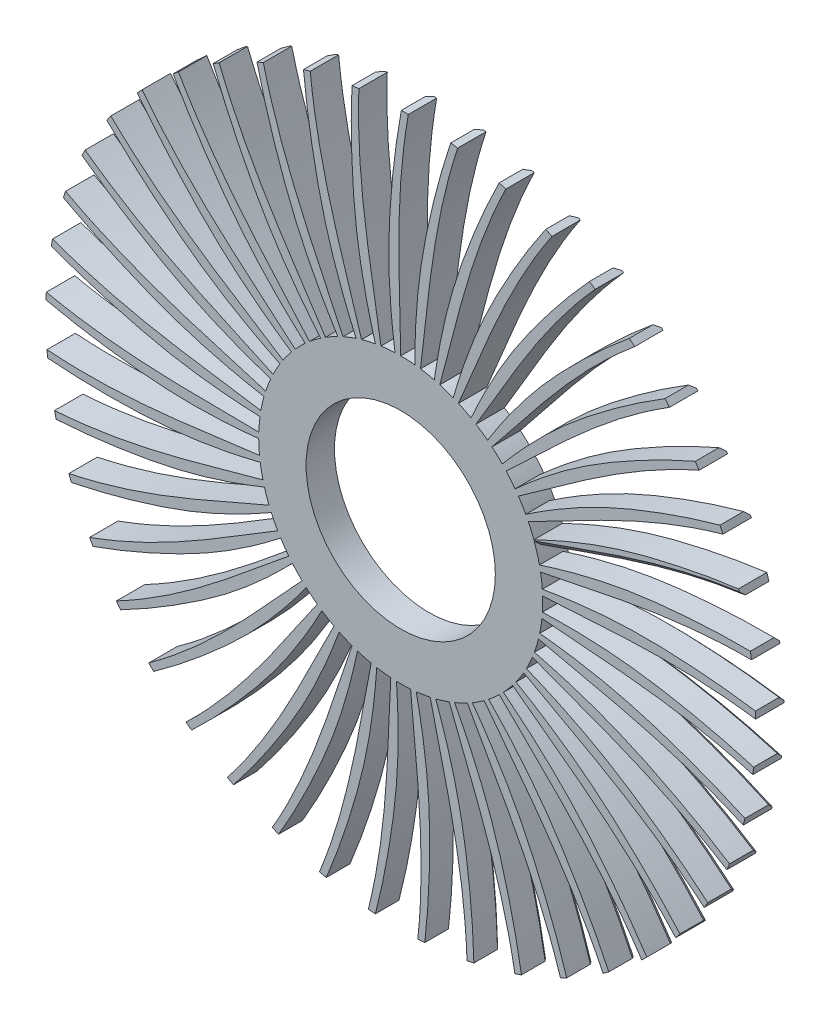
from build123d import *

# Parameters (mm, degrees)
BOSS_EXTRUDE1_DEPTH = 30
CHAMFER1_SIZE       = 5
SKETCH4_R           = 100
CUT_EXTRUDE4_DEPTH  = 30


with BuildPart() as part:
    # Sketch2 → Boss-Extrude1 (new body)
    with BuildSketch(Plane.XY):
        with BuildLine():
            ThreePointArc((-367.818143925, 73.039804216), (-368.519088855, 69.416720967), (-369.184346577, 65.786915438))
            add(Edge.make_bspline(
                [(-148.644827779, 20.117534009), (-208.67442649, 22.353179801), (-256.791443609, 31.100647398), (-328.615150785, 51.598785702), (-352.922592098, 59.639700165), (-369.184346577, 65.786915438)],
                knots=[0, 0, 0, 0, 0.599000586, 0.68864658, 0.896459938, 0.896459938, 0.896459938, 0.896459938], degree=3))
            ThreePointArc((-148.644827779, 20.117534009), (-149.462081869, 12.69196925), (-149.908624053, 5.234924505))
            add(Edge.make_bspline(
                [(-149.908624053, 5.234924505), (-225.73533437, 6.314146942), (-293.967928078, 3.961468461), (-374.403739079, 21.138594182)],
                knots=[0, 0, 0, 0, 0.908524, 0.908524, 0.908524, 0.908524], degree=3))
            ThreePointArc((-374.403739079, 21.138594182), (-374.59362673, 17.453217852), (-374.747238918, 13.76615136))
            add(Edge.make_bspline(
                [(-149.998046125, -0.765610073), (-209.754582665, -6.906226834), (-258.620740472, -4.940483472), (-332.598253739, 5.36224031), (-357.788215705, 9.941959162), (-374.747238918, 13.76615136)],
                knots=[0, 0, 0, 0, 0.599000586, 0.68864658, 0.896459938, 0.896459938, 0.896459938, 0.896459938], degree=3))
            ThreePointArc((-149.998046125, -0.765610073), (-149.77390788, -8.232649532), (-149.178284305, -15.67926949))
            add(Edge.make_bspline(
                [(-149.178284305, -15.67926949), (-224.417253024, -25.163588382), (-291.65838226, -36.989512411), (-373.701991329, -31.174054542)],
                knots=[0, 0, 0, 0, 0.908524, 0.908524, 0.908524, 0.908524], degree=3))
            ThreePointArc((-373.701991329, -31.174054542), (-373.377125755, -34.849992297), (-373.016102523, -38.522555195))
            add(Edge.make_bspline(
                [(-148.431723123, -21.633852425), (-206.752104481, -36.031211619), (-255.416278799, -40.88545345), (-330.107710009, -40.978674991), (-355.689898671, -39.949290768), (-373.016102523, -38.522555195)],
                knots=[0, 0, 0, 0, 0.599000586, 0.68864658, 0.896459938, 0.896459938, 0.896459938, 0.896459938], degree=3))
            ThreePointArc((-148.431723123, -21.633852425), (-147.17055514, -28.997029155), (-145.544358941, -36.28828434))
            add(Edge.make_bspline(
                [(-145.544358941, -36.28828434), (-218.731145118, -56.151543082), (-283.672037787, -77.220534499), (-365.726559398, -82.879935754)],
                knots=[0, 0, 0, 0, 0.908524, 0.908524, 0.908524, 0.908524], degree=3))
            ThreePointArc((-365.726559398, -82.879935754), (-364.893263737, -86.474886986), (-364.024631991, -90.061464032))
            add(Edge.make_bspline(
                [(-143.976345469, -42.081016449), (-199.72543176, -64.454889855), (-247.24042979, -76.034634584), (-321.191995196, -86.521986996), (-346.66848235, -89.062973195), (-364.024631991, -90.061464032)],
                knots=[0, 0, 0, 0, 0.599000586, 0.68864658, 0.896459938, 0.896459938, 0.896459938, 0.896459938], degree=3))
            ThreePointArc((-143.976345469, -42.081016449), (-141.702694948, -49.19701459), (-139.077578185, -56.190989012))
            add(Edge.make_bspline(
                [(-139.077578185, -56.190989012), (-208.787684275, -86.046571868), (-270.164339771, -115.94854672), (-350.632675997, -132.972653291)],
                knots=[0, 0, 0, 0, 0.908524, 0.908524, 0.908524, 0.908524], degree=3))
            ThreePointArc((-350.632675997, -132.972653291), (-349.307169401, -136.416646364), (-347.94783607, -139.847428915))
            add(Edge.make_bspline(
                [(-136.718632022, -61.709121353), (-188.811330695, -91.624026976), (-234.252327048, -109.703888043), (-306.024643546, -130.381246941), (-330.89955835, -136.443146156), (-347.94783607, -139.847428915)],
                knots=[0, 0, 0, 0, 0.599000586, 0.68864658, 0.896459938, 0.896459938, 0.896459938, 0.896459938], degree=3))
            ThreePointArc((-136.718632022, -61.709121353), (-133.476752983, -68.439436096), (-129.903810568, -75))
            add(Edge.make_bspline(
                [(-129.903810568, -75), (-194.78040865, -114.266802008), (-251.39820019, -152.419752369), (-328.714126396, -180.477209387)],
                knots=[0, 0, 0, 0, 0.908524, 0.908524, 0.908524, 0.908524], degree=3))
            ThreePointArc((-328.714126396, -180.477209387), (-326.922208343, -183.703210892), (-325.098631304, -186.911422669))
            add(Edge.make_bspline(
                [(-126.799845917, -80.136128403), (-174.222231847, -117.009806633), (-216.704769217, -141.237880109), (-284.900870308, -171.702784221), (-308.69005084, -181.167608479), (-325.098631304, -186.911422669)],
                knots=[0, 0, 0, 0, 0.599000586, 0.68864658, 0.896459938, 0.896459938, 0.896459938, 0.896459938], degree=3))
            ThreePointArc((-126.799845917, -80.136128403), (-122.652837849, -86.349761827), (-118.201613041, -92.349221299))
            add(Edge.make_bspline(
                [(-118.201613041, -92.349221299), (-176.98195393, -140.262958824), (-227.738880602, -185.924280912), (-300.397530231, -224.468981891)],
                knots=[0, 0, 0, 0, 0.908524, 0.908524, 0.908524, 0.908524], degree=3))
            ThreePointArc((-300.397530231, -224.468981891), (-298.174078368, -227.41420138), (-295.921751475, -230.337398188))
            add(Edge.make_bspline(
                [(-114.413045044, -97.003376868), (-156.242095431, -140.118123501), (-194.939299552, -170.022837493), (-258.231825699, -209.682322115), (-280.472242619, -222.365849377), (-295.921751475, -230.337398188)],
                knots=[0, 0, 0, 0, 0.599000586, 0.68864658, 0.896459938, 0.896459938, 0.896459938, 0.896459938], degree=3))
            ThreePointArc((-114.413045044, -97.003376868), (-109.441624742, -102.579387666), (-104.198755569, -107.900970051))
            add(Edge.make_bspline(
                [(-104.198755569, -107.900970051), (-155.738746791, -163.529056693), (-199.646882753, -215.810004814), (-266.234037837, -264.091720993)],
                knots=[0, 0, 0, 0, 0.908524, 0.908524, 0.908524, 0.908524], degree=3))
            ThreePointArc((-266.234037837, -264.091720993), (-263.622329126, -266.698833117), (-260.985091358, -269.280118257))
            add(Edge.make_bspline(
                [(-99.799324392, -111.982564942), (-135.22088435, -160.499200477), (-169.379558162, -195.498493744), (-226.536592337, -243.580632119), (-246.795361229, -259.235991956), (-260.985091358, -269.280118257)],
                knots=[0, 0, 0, 0, 0.599000586, 0.68864658, 0.896459938, 0.896459938, 0.896459938, 0.896459938], degree=3))
            ThreePointArc((-99.799324392, -111.982564942), (-94.100254897, -116.812422406), (-88.167787844, -121.352549156))
            add(Edge.make_bspline(
                [(-88.167787844, -121.352549156), (-131.464262096, -183.612247485), (-167.668985426, -241.495232452), (-226.888602734, -298.574215145)],
                knots=[0, 0, 0, 0, 0.908524, 0.908524, 0.908524, 0.908524], degree=3))
            ThreePointArc((-226.888602734, -298.574215145), (-223.939471114, -300.792475433), (-220.968653305, -302.981607126))
            add(Edge.make_bspline(
                [(-83.243123411, -124.782139767), (-111.567752567, -177.75634308), (-140.523036338, -217.16899419), (-190.432081887, -272.737922188), (-208.314888858, -291.060400827), (-220.968653305, -302.981607126)],
                knots=[0, 0, 0, 0, 0.599000586, 0.68864658, 0.896459938, 0.896459938, 0.896459938, 0.896459938], degree=3))
            ThreePointArc((-83.243123411, -124.782139767), (-76.927330628, -128.771836216), (-70.420734418, -132.442138929))
            add(Edge.make_bspline(
                [(-70.420734418, -132.442138929), (-104.630975078, -200.121634736), (-132.427602018, -262.480030087), (-183.12703906, -327.245301823)],
                knots=[0, 0, 0, 0, 0.908524, 0.908524, 0.908524, 0.908524], degree=3))
            ThreePointArc((-183.12703906, -327.245301823), (-179.897886023, -329.031534362), (-176.651311763, -330.785903648))
            add(Edge.make_bspline(
                [(-65.066689721, -135.152972179), (-85.743081387, -191.55366066), (-108.931393454, -234.612547191), (-150.621027577, -296.586678836), (-165.779804129, -317.219650073), (-176.651311763, -330.785903648)],
                knots=[0, 0, 0, 0, 0.599000586, 0.68864658, 0.896459938, 0.896459938, 0.896459938, 0.896459938], degree=3))
            ThreePointArc((-65.066689721, -135.152972179), (-58.257103372, -138.22485271), (-51.303021499, -140.953893118))
            add(Edge.make_bspline(
                [(-51.303021499, -140.953893118), (-75.761165146, -212.735882001), (-94.608665971, -278.355952503), (-135.801115875, -349.546930936)],
                knots=[0, 0, 0, 0, 0.908524, 0.908524, 0.908524, 0.908524], degree=3))
            ThreePointArc((-135.801115875, -349.546930936), (-132.354793212, -350.866368741), (-128.895653376, -352.151828819))
            add(Edge.make_bspline(
                [(-45.623806927, -142.893205722), (-58.249518658, -201.622604125), (-75.219524904, -247.489633828), (-107.878306293, -314.662713143), (-120.018004085, -337.204579661), (-128.895653376, -352.151828819)],
                knots=[0, 0, 0, 0, 0.599000586, 0.68864658, 0.896459938, 0.896459938, 0.896459938, 0.896459938], degree=3))
            ThreePointArc((-45.623806927, -142.893205722), (-38.452967865, -144.987479675), (-31.186753623, -146.72214011))
            add(Edge.make_bspline(
                [(-31.186753623, -146.72214011), (-45.416750311, -221.209467307), (-54.948279857, -288.813992929), (-85.831978442, -365.045026643)],
                knots=[0, 0, 0, 0, 0.908524, 0.908524, 0.908524, 0.908524], degree=3))
            ThreePointArc((-85.831978442, -365.045026643), (-82.235564903, -365.871988358), (-78.631187712, -366.663519209))
            add(Edge.make_bspline(
                [(-25.292908628, -147.852185554), (-29.622195307, -207.767192943), (-40.043593863, -255.549616258), (-63.035856488, -326.614195663), (-71.92019011, -350.626205672), (-78.631187712, -366.663519209)],
                knots=[0, 0, 0, 0, 0.599000586, 0.68864658, 0.896459938, 0.896459938, 0.896459938, 0.896459938], degree=3))
            ThreePointArc((-25.292908628, -147.852185554), (-17.900389078, -148.928090268), (-10.463471062, -149.634607539))
            add(Edge.make_bspline(
                [(-10.463471062, -149.634607539), (-14.188350092, -225.377461954), (-14.218387978, -293.650597503), (-34.19221918, -373.437936139)],
                knots=[0, 0, 0, 0, 0.908524, 0.908524, 0.908524, 0.908524], degree=3))
            ThreePointArc((-34.19221918, -373.437936139), (-30.515714864, -373.756325895), (-26.836255421, -374.038521271))
            add(Edge.make_bspline(
                [(-4.469712632, -149.933390774), (-0.418309619, -209.867829681), (-4.088259817, -258.635616091), (-16.966485437, -332.208504381), (-22.422531443, -357.22329142), (-26.836255421, -374.038521271)],
                knots=[0, 0, 0, 0, 0.599000586, 0.68864658, 0.896459938, 0.896459938, 0.896459938, 0.896459938], degree=3))
            ThreePointArc((-4.469712632, -149.933390774), (3.00060042, -149.969984987), (10.463471062, -149.634607539))
            add(Edge.make_bspline(
                [(10.463471062, -149.634607539), (17.316210222, -225.158740666), (26.78824865, -292.77162722), (18.113052736, -374.562300987)],
                knots=[0, 0, 0, 0, 0.908524, 0.908524, 0.908524, 0.908524], degree=3))
            ThreePointArc((18.113052736, -374.562300987), (21.798088854, -374.365921689), (25.481014056, -374.13328898))
            add(Edge.make_bspline(
                [(16.440481235, -149.096313089), (28.79371799, -207.883627836), (31.946647557, -256.687567851), (29.433118953, -331.336752444), (27.511556294, -356.867432136), (25.481014056, -374.13328898)],
                knots=[0, 0, 0, 0, 0.599000586, 0.68864658, 0.896459938, 0.896459938, 0.896459938, 0.896459938], degree=3))
            ThreePointArc((16.440481235, -149.096313089), (23.843186645, -148.092884537), (31.186753623, -146.72214011))
            add(Edge.make_bspline(
                [(31.186753623, -146.72214011), (48.483730202, -220.557560606), (67.273482489, -286.194190235), (70.065774683, -368.396236705)],
                knots=[0, 0, 0, 0, 0.908524, 0.908524, 0.908524, 0.908524], degree=3))
            ThreePointArc((70.065774683, -368.396236705), (73.687617567, -367.688910653), (77.302324578, -366.945977788))
            add(Edge.make_bspline(
                [(37.030679836, -145.357245264), (57.445308631, -201.85320764), (67.359749775, -249.74338808), (75.259841162, -324.01590751), (76.910162881, -349.565554217), (77.302324578, -366.945977788)],
                knots=[0, 0, 0, 0, 0.599000586, 0.68864658, 0.896459938, 0.896459938, 0.896459938, 0.896459938], degree=3))
            ThreePointArc((37.030679836, -145.357245264), (44.221692363, -143.333324543), (51.303021499, -140.953893118))
            add(Edge.make_bspline(
                [(51.303021499, -140.953893118), (78.707569522, -211.66347851), (106.449314513, -274.046308879), (120.654746024, -355.059758719)],
                knots=[0, 0, 0, 0, 0.908524, 0.908524, 0.908524, 0.908524], degree=3))
            ThreePointArc((120.654746024, -355.059758719), (124.142900622, -353.855253211), (127.619033283, -352.616480534))
            add(Edge.make_bspline(
                [(56.900118376, -138.788964002), (84.978791682, -191.893944361), (101.461771084, -237.938237338), (119.62171617, -310.388461499), (124.811800632, -335.459780409), (127.619033283, -352.616480534)],
                knots=[0, 0, 0, 0, 0.599000586, 0.68864658, 0.896459938, 0.896459938, 0.896459938, 0.896459938], degree=3))
            ThreePointArc((56.900118376, -138.788964002), (63.73947314, -135.783944426), (70.420734418, -132.442138929))
            add(Edge.make_bspline(
                [(70.420734418, -132.442138929), (107.39945553, -198.649607568), (143.553231715, -256.564427844), (168.895309977, -334.812446405)],
                knots=[0, 0, 0, 0, 0.908524, 0.908524, 0.908524, 0.908524], degree=3))
            ThreePointArc((168.895309977, -334.812446405), (172.181883327, -333.13420577), (175.451782669, -331.423704581))
            add(Edge.make_bspline(
                [(75.662060835, -129.519313426), (110.858259215, -178.199683731), (133.588954429, -221.501889458), (161.65529054, -290.719657147), (170.284118655, -314.824663556), (175.451782669, -331.423704581)],
                knots=[0, 0, 0, 0, 0.599000586, 0.68864658, 0.896459938, 0.896459938, 0.896459938, 0.896459938], degree=3))
            ThreePointArc((75.662060835, -129.519313426), (82.016637575, -125.591684282), (88.167787844, -121.352549156))
            add(Edge.make_bspline(
                [(88.167787844, -121.352549156), (134.000933301, -181.769247975), (177.863048551, -234.088812058), (213.848518836, -308.048390665)],
                knots=[0, 0, 0, 0, 0.908524, 0.908524, 0.908524, 0.908524], degree=3))
            ThreePointArc((213.848518836, -308.048390665), (216.869541528, -305.929079947), (219.869562679, -303.780143208))
            add(Edge.make_bspline(
                [(92.951327344, -117.728716739), (134.579996832, -161.036968957), (163.115980732, -200.754259255), (200.54242856, -265.392325357), (212.442050004, -288.061842734), (219.869562679, -303.780143208)],
                knots=[0, 0, 0, 0, 0.599000586, 0.68864658, 0.896459938, 0.896459938, 0.896459938, 0.896459938], degree=3))
            ThreePointArc((92.951327344, -117.728716739), (98.697441453, -112.954924862), (104.198755569, -107.900970051))
            add(Edge.make_bspline(
                [(104.198755569, -107.900970051), (157.99423533, -161.350956729), (208.710963464, -207.056923818), (254.639409526, -275.288523401)],
                knots=[0, 0, 0, 0, 0.908524, 0.908524, 0.908524, 0.908524], degree=3))
            ThreePointArc((254.639409526, -275.288523401), (257.336080788, -272.769392573), (260.00783175, -270.223846892))
            add(Edge.make_bspline(
                [(108.431401996, -103.646664496), (155.682287893, -140.739852759), (189.468140012, -176.099175749), (235.526236322, -234.899433834), (250.465038498, -255.692225809), (260.00783175, -270.223846892)],
                knots=[0, 0, 0, 0, 0.599000586, 0.68864658, 0.896459938, 0.896459938, 0.896459938, 0.896459938], degree=3))
            ThreePointArc((108.431401996, -103.646664496), (113.457211899, -98.119626314), (118.201613041, -92.349221299))
            add(Edge.make_bspline(
                [(118.201613041, -92.349221299), (178.912359283, -137.792152645), (235.496556877, -175.994908079), (290.474033757, -237.170478165)],
                knots=[0, 0, 0, 0, 0.908524, 0.908524, 0.908524, 0.908524], degree=3))
            ThreePointArc((290.474033757, -237.170478165), (292.793865951, -234.300559243), (295.08534413, -231.407950771))
            add(Edge.make_bspline(
                [(121.800982748, -87.547247825), (173.754400306, -117.703395416), (212.132517463, -148.016522097), (265.925793801, -199.834492025), (283.613009918, -218.345850555), (295.08534413, -231.407950771)],
                knots=[0, 0, 0, 0, 0.599000586, 0.68864658, 0.896459938, 0.896459938, 0.896459938, 0.896459938], degree=3))
            ThreePointArc((121.800982748, -87.547247825), (126.008666771, -81.37454085), (129.903810568, -75))
            add(Edge.make_bspline(
                [(129.903810568, -75), (196.348157673, -111.551381046), (257.698477685, -141.507351645), (320.654911331, -194.436179348)],
                knots=[0, 0, 0, 0, 0.908524, 0.908524, 0.908524, 0.908524], degree=3))
            ThreePointArc((320.654911331, -194.436179348), (322.552751561, -191.27133204), (324.419355941, -188.087962111))
            add(Edge.make_bspline(
                [(132.799845917, -69.743823558), (188.44458096, -92.375975367), (230.667976759, -117.052895209), (291.14940819, -160.879999137), (311.240776705, -176.749621683), (324.419355941, -188.087962111)],
                knots=[0, 0, 0, 0, 0.599000586, 0.68864658, 0.896459938, 0.896459938, 0.896459938, 0.896459938], degree=3))
            ThreePointArc((132.799845917, -69.743823558), (136.107506278, -63.04559251), (139.077578185, -56.190989012))
            add(Edge.make_bspline(
                [(139.077578185, -56.190989012), (209.962262516, -83.139388703), (274.884590752, -104.265515575), (344.594605795, -147.917401469)],
                knots=[0, 0, 0, 0, 0.908524, 0.908524, 0.908524, 0.908524], degree=3))
            ThreePointArc((344.594605795, -147.917401469), (346.03351476, -144.519225927), (347.43891401, -141.107055215))
            add(Edge.make_bspline(
                [(141.213911143, -50.582915098), (199.466902198, -65.250562033), (244.713746269, -83.810966862), (310.706130526, -118.794160064), (332.810595805, -131.713162476), (347.43891401, -141.107055215)],
                knots=[0, 0, 0, 0, 0.599000586, 0.68864658, 0.896459938, 0.896459938, 0.896459938, 0.896459938], degree=3))
            ThreePointArc((141.213911143, -50.582915098), (143.557167994, -43.489533425), (145.544358941, -36.28828434))
            add(Edge.make_bspline(
                [(145.544358941, -36.28828434), (219.489690749, -53.109182728), (286.720387936, -64.994269843), (361.827158227, -98.519579623)],
                knots=[0, 0, 0, 0, 0.908524, 0.908524, 0.908524, 0.908524], degree=3))
            ThreePointArc((361.827158227, -98.519579623), (362.779129202, -94.95421747), (363.695968824, -91.379659997))
            add(Edge.make_bspline(
                [(146.879408216, -30.437467733), (206.606827075, -36.855120731), (253.996441065, -48.937753378), (324.215311454, -74.396127791), (347.902635223, -84.113056382), (363.695968824, -91.379659997)],
                knots=[0, 0, 0, 0, 0.599000586, 0.68864658, 0.896459938, 0.896459938, 0.896459938, 0.896459938], degree=3))
            ThreePointArc((146.879408216, -30.437467733), (148.21265273, -23.08700004), (149.178284305, -15.67926949))
            add(Edge.make_bspline(
                [(149.178284305, -15.67926949), (224.745001816, -22.045266923), (292.975498909, -24.45798458), (372.017156597, -47.204186225)],
                knots=[0, 0, 0, 0, 0.908524, 0.908524, 0.908524, 0.908524], degree=3))
            ThreePointArc((372.017156597, -47.204186225), (372.463660549, -43.541033178), (372.874095303, -39.873663639))
            add(Edge.make_bspline(
                [(149.686064682, -9.699589681), (209.725385075, -7.742336426), (258.335384052, -13.11202219), (331.414010134, -28.550059516), (356.223145581, -34.875785324), (372.874095303, -39.873663639)],
                knots=[0, 0, 0, 0, 0.599000586, 0.68864658, 0.896459938, 0.896459938, 0.896459938, 0.896459938], degree=3))
            ThreePointArc((149.686064682, -9.699589681), (149.983346769, -2.235104461), (149.908624053, 5.234924505))
            add(Edge.make_bspline(
                [(149.908624053, 5.234924505), (225.625907067, 9.447734928), (293.52817505, 16.554347534), (374.966264178, 5.029982965)],
                knots=[0, 0, 0, 0, 0.908524, 0.908524, 0.908524, 0.908524], degree=3))
            ThreePointArc((374.966264178, 5.029982965), (374.898610415, 8.719627797), (374.794651655, 12.408428225))
            add(Edge.make_bspline(
                [(149.579252164, 11.227079851), (208.761877013, 21.521143651), (257.646122641, 22.968919595), (332.162112085, 17.851703192), (357.610177607, 15.040303226), (374.794651655, 12.408428225)],
                knots=[0, 0, 0, 0, 0.599000586, 0.68864658, 0.896459938, 0.896459938, 0.896459938, 0.896459938], degree=3))
            ThreePointArc((149.579252164, 11.227079851), (148.834785567, 18.660294884), (147.721162952, 26.04722665))
            add(Edge.make_bspline(
                [(147.721162952, 26.04722665), (222.115260682, 40.756847364), (288.367659148, 57.244468102), (370.617079943, 57.166249257)],
                knots=[0, 0, 0, 0, 0.908524, 0.908524, 0.908524, 0.908524], degree=3))
            ThreePointArc((370.617079943, 57.166249257), (370.03658527, 60.810571136), (369.420256435, 64.449004149))
            add(Edge.make_bspline(
                [(146.561049647, 31.935227045), (203.735056479, 50.365739146), (251.942072521, 58.602797486), (326.445056352, 63.906002804), (352.036734302, 64.663649381), (369.420256435, 64.449004149)],
                knots=[0, 0, 0, 0, 0.599000586, 0.68864658, 0.896459938, 0.896459938, 0.896459938, 0.896459938], degree=3))
            ThreePointArc((146.561049647, 31.935227045), (144.789324561, 39.192492815), (142.658477444, 46.352549156))
            add(Edge.make_bspline(
                [(142.658477444, 46.352549156), (214.281393401, 71.272674127), (277.594394773, 96.820390214), (359.054255819, 108.189839534)],
                knots=[0, 0, 0, 0, 0.908524, 0.908524, 0.908524, 0.908524], degree=3))
            ThreePointArc((359.054255819, 108.189839534), (357.972218903, 111.717905879), (356.855516132, 115.235153516))
            add(Edge.make_bspline(
                [(140.690203009, 52.02179137), (194.742764815, 78.230022819), (241.334256539, 93.096038585), (314.374118924, 108.716444764), (339.6112964, 113.028391155), (356.855516132, 115.235153516)],
                knots=[0, 0, 0, 0, 0.599000586, 0.68864658, 0.896459938, 0.896459938, 0.896459938, 0.896459938], degree=3))
            ThreePointArc((140.690203009, 52.02179137), (137.925704048, 58.961853455), (134.819106945, 65.755672018))
            add(Edge.make_bspline(
                [(134.819106945, 65.755672018), (202.276782538, 100.401259359), (261.418071263, 134.511813562), (340.502849023, 157.107637648)],
                knots=[0, 0, 0, 0, 0.908524, 0.908524, 0.908524, 0.908524], degree=3))
            ThreePointArc((340.502849023, 157.107637648), (338.940330482, 160.45077866), (337.344989126, 163.778381698))
            add(Edge.make_bspline(
                [(132.080981602, 71.0958107), (181.960026751, 104.571648084), (226.029143767, 125.777271187), (296.184246866, 151.410844789), (320.575710915, 159.193163863), (337.344989126, 163.778381698)],
                knots=[0, 0, 0, 0, 0.599000586, 0.68864658, 0.896459938, 0.896459938, 0.896459938, 0.896459938], degree=3))
            ThreePointArc((132.080981602, 71.0958107), (128.377516594, 77.583588684), (124.355635883, 83.878935521))
            add(Edge.make_bspline(
                [(124.355635883, 83.878935521), (186.33508419, 127.575648283), (240.153542355, 169.585117463), (315.323941587, 202.967514302)],
                knots=[0, 0, 0, 0, 0.908524, 0.908524, 0.908524, 0.908524], degree=3))
            ThreePointArc((315.323941587, 202.967514302), (313.311354067, 206.060659546), (311.26842563, 209.133849976))
            add(Edge.make_bspline(
                [(120.900954128, 88.786030945), (165.635643742, 128.877905167), (206.324630816, 156.010392275), (272.229485348, 191.158204948), (295.300483867, 202.259422716), (311.26842563, 209.133849976)],
                knots=[0, 0, 0, 0, 0.599000586, 0.68864658, 0.896459938, 0.896459938, 0.896459938, 0.896459938], degree=3))
            ThreePointArc((120.900954128, 88.786030945), (116.330606807, 94.69524761), (111.471723822, 100.369590954))
            add(Edge.make_bspline(
                [(111.471723822, 100.369590954), (166.766585381, 152.266922328), (214.214697915, 201.357639954), (284.007612304, 244.876859163)],
                knots=[0, 0, 0, 0, 0.908524, 0.908524, 0.908524, 0.908524], degree=3))
            ThreePointArc((284.007612304, 244.876859163), (281.584128532, 247.659804084), (279.133376292, 250.41876575))
            add(Edge.make_bspline(
                [(107.367727105, 104.74813209), (146.087351336, 150.675700422), (182.604243617, 183.206948537), (242.976086553, 227.184888086), (264.277568799, 241.388931973), (279.133376292, 250.41876575)],
                knots=[0, 0, 0, 0, 0.599000586, 0.68864658, 0.896459938, 0.896459938, 0.896459938, 0.896459938], degree=3))
            ThreePointArc((107.367727105, 104.74813209), (102.019454082, 109.963771256), (96.418141453, 114.906666468))
            add(Edge.make_bspline(
                [(96.418141453, 114.906666468), (143.952164682, 173.994493931), (184.106408046, 229.210965023), (247.163397901, 282.019954503)],
                knots=[0, 0, 0, 0, 0.908524, 0.908524, 0.908524, 0.908524], degree=3))
            ThreePointArc((247.163397901, 282.019954503), (244.376188232, 284.438532244), (241.565313294, 286.829565096))
            add(Edge.make_bspline(
                [(91.744709403, 118.671429993), (123.695634808, 169.54076456), (155.329672525, 206.837589941), (208.993434615, 258.789675797), (228.110791466, 275.820080244), (241.565313294, 286.829565096)],
                knots=[0, 0, 0, 0, 0.599000586, 0.68864658, 0.896459938, 0.896459938, 0.896459938, 0.896459938], degree=3))
            ThreePointArc((91.744709403, 118.671429993), (85.722608729, 123.091975176), (79.487889635, 127.207214423))
            add(Edge.make_bspline(
                [(79.487889635, 127.207214423), (118.33587884, 192.335460626), (150.414696363, 252.602959383), (205.508429102, 313.673852222)],
                knots=[0, 0, 0, 0, 0.908524, 0.908524, 0.908524, 0.908524], degree=3))
            ThreePointArc((205.508429102, 313.673852222), (202.411743402, 315.680987918), (199.295456249, 317.657553221))
            add(Edge.make_bspline(
                [(74.33598529, 130.284923498), (98.89632345, 185.105910565), (125.031786042, 226.44237293), (170.942963199, 285.357416838), (187.50409705, 304.882704394), (199.295456249, 317.657553221)],
                knots=[0, 0, 0, 0, 0.599000586, 0.68864658, 0.896459938, 0.896459938, 0.896459938, 0.896459938], degree=3))
            ThreePointArc((74.33598529, 130.284923498), (67.757270305, 133.824333814), (61.010496461, 137.031818646))
            add(Edge.make_bspline(
                [(61.010496461, 137.031818646), (90.416319722, 206.932836357), (113.795333708, 271.078324469), (159.853472493, 339.222445207)],
                knots=[0, 0, 0, 0, 0.908524, 0.908524, 0.908524, 0.908524], degree=3))
            ThreePointArc((159.853472493, 339.222445207), (156.507584227, 340.779072244), (153.146539844, 342.302698403))
            add(Edge.make_bspline(
                [(55.480395779, 139.362569165), (72.172107649, 197.068180576), (92.300298066, 241.639712705), (129.565281449, 306.371000348), (143.247848667, 328.011133502), (153.146539844, 342.302698403)],
                knots=[0, 0, 0, 0, 0.599000586, 0.68864658, 0.896459938, 0.896459938, 0.896459938, 0.896459938], degree=3))
            ThreePointArc((55.480395779, 139.362569165), (48.473113687, 141.951954018), (41.345603373, 144.189254391))
            add(Edge.make_bspline(
                [(41.345603373, 144.189254391), (60.736909788, 217.502499812), (74.961074324, 284.277458317), (111.087149873, 358.168459155)],
                knots=[0, 0, 0, 0, 0.908524, 0.908524, 0.908524, 0.908524], degree=3))
            ThreePointArc((111.087149873, 358.168459155), (107.55718295, 359.244279559), (104.016800242, 360.285310924))
            add(Edge.make_bspline(
                [(35.544943473, 145.727680945), (44.043143868, 205.194742614), (57.772289778, 252.133810333), (85.665758873, 321.421420829), (96.203443852, 344.755199004), (104.016800242, 360.285310924)],
                knots=[0, 0, 0, 0, 0.599000586, 0.68864658, 0.896459938, 0.896459938, 0.896459938, 0.896459938], degree=3))
            ThreePointArc((35.544943473, 145.727680945), (28.245483049, 147.316640904), (20.875965144, 148.540210311))
            add(Edge.make_bspline(
                [(20.875965144, 148.540210311), (29.875324991, 223.838724513), (34.667782894, 291.943454799), (60.15864224, 370.143131456)],
                knots=[0, 0, 0, 0, 0.908524, 0.908524, 0.908524, 0.908524], degree=3))
            ThreePointArc((60.15864224, 370.143131456), (56.51330345, 370.717205607), (52.86249194, 371.255379686))
            add(Edge.make_bspline(
                [(14.917649274, 149.256369178), (15.056930389, 209.327422392), (22.119809584, 257.720410141), (40.098849745, 330.215738965), (47.286548432, 354.78899671), (52.86249194, 371.255379686)],
                knots=[0, 0, 0, 0, 0.599000586, 0.68864658, 0.896459938, 0.896459938, 0.896459938, 0.896459938], degree=3))
            ThreePointArc((14.917649274, 149.256369178), (7.468086212, 149.813976946), (0, 150))
            add(Edge.make_bspline(
                [(0, 150), (-1.567749023, 225.818183054), (-6.300277495, 293.927104014), (8.059215065, 374.913388735)],
                knots=[0, 0, 0, 0, 0.908524, 0.908524, 0.908524, 0.908524], degree=3))
            ThreePointArc((8.059215065, 374.913388735), (4.369456782, 374.974542932), (0.679275364, 374.999384779))
            add(Edge.make_bspline(
                [(-6, 149.879951962), (-14.222349113, 209.385782), (-13.963207542, 258.290775318), (-6.248537882, 332.582783357), (-2.550725865, 357.917230162), (0.679275364, 374.999384779)],
                knots=[0, 0, 0, 0, 0.599000586, 0.68864658, 0.896459938, 0.896459938, 0.896459938, 0.896459938], degree=3))
            ThreePointArc((-6, 149.879951962), (-13.454668429, 149.395354337), (-20.875965144, 148.540210311))
            add(Edge.make_bspline(
                [(-20.875965144, 148.540210311), (-32.980308586, 223.402347527), (-47.14571015, 290.189796487), (-44.197075564, 372.38638336)],
                knots=[0, 0, 0, 0, 0.908524, 0.908524, 0.908524, 0.908524], degree=3))
            ThreePointArc((-44.197075564, 372.38638336), (-47.859436392, 371.933427307), (-51.517162536, 371.444453404))
            add(Edge.make_bspline(
                [(-26.800866099, 147.586291966), (-43.224806767, 205.368685534), (-49.774446716, 253.833804355), (-52.474304826, 328.476482179), (-52.338353185, 354.079011853), (-51.517162536, 371.444453404)],
                knots=[0, 0, 0, 0, 0.599000586, 0.68864658, 0.896459938, 0.896459938, 0.896459938, 0.896459938], degree=3))
            ThreePointArc((-26.800866099, 147.586291966), (-34.115543253, 146.068921091), (-41.345603373, 144.189254391))
            add(Edge.make_bspline(
                [(-41.345603373, 144.189254391), (-63.750943957, 216.638239421), (-87.073505184, 280.804274657), (-95.59312039, 362.611300615)],
                knots=[0, 0, 0, 0, 0.908524, 0.908524, 0.908524, 0.908524], degree=3))
            ThreePointArc((-95.59312039, 362.611300615), (-99.156800076, 361.653050587), (-102.710877466, 360.659778254))
            add(Edge.make_bspline(
                [(-47.080083824, 142.420032675), (-71.385942725, 197.354321208), (-84.616882903, 244.436247122), (-97.678719116, 317.976759911), (-101.107273994, 343.349048338), (-102.710877466, 360.659778254)],
                knots=[0, 0, 0, 0, 0.599000586, 0.68864658, 0.896459938, 0.896459938, 0.896459938, 0.896459938], degree=3))
            ThreePointArc((-47.080083824, 142.420032675), (-54.112397833, 139.899422446), (-61.010496461, 137.031818646))
            add(Edge.make_bspline(
                [(-61.010496461, 137.031818646), (-93.28073972, 205.657514408), (-125.306513483, 265.953217031), (-145.128553864, 345.778401369)],
                knots=[0, 0, 0, 0, 0.908524, 0.908524, 0.908524, 0.908524], degree=3))
            ThreePointArc((-145.128553864, 345.778401369), (-148.524189436, 344.333508611), (-151.905441998, 342.855270765))
            add(Edge.make_bspline(
                [(-66.442941271, 134.481729448), (-98.157632508, 185.498679506), (-117.812347714, 230.28101638), (-140.981928246, 301.287981704), (-147.908256723, 325.936186151), (-151.905441998, 342.855270765)],
                knots=[0, 0, 0, 0, 0.599000586, 0.68864658, 0.896459938, 0.896459938, 0.896459938, 0.896459938], degree=3))
            ThreePointArc((-66.442941271, 134.481729448), (-73.056016141, 131.006940677), (-79.487889635, 127.207214423))
            add(Edge.make_bspline(
                [(-79.487889635, 127.207214423), (-120.994931989, 190.673899808), (-161.100573033, 245.925682553), (-191.839225117, 322.215318857)],
                knots=[0, 0, 0, 0, 0.908524, 0.908524, 0.908524, 0.908524], degree=3))
            ThreePointArc((-191.839225117, 322.215318857), (-195.000724392, 320.311906564), (-198.143339892, 318.377475423))
            add(Edge.make_bspline(
                [(-84.512562444, 123.925892328), (-123.018795627, 170.03251701), (-148.714729187, 211.643627596), (-181.541084508, 278.734975644), (-191.830373478, 302.179346847), (-198.143339892, 318.377475423)],
                knots=[0, 0, 0, 0, 0.599000586, 0.68864658, 0.896459938, 0.896459938, 0.896459938, 0.896459938], degree=3))
            ThreePointArc((-84.512562444, 123.925892328), (-90.577682196, 119.564557826), (-96.418141453, 114.906666468))
            add(Edge.make_bspline(
                [(-96.418141453, 114.906666468), (-146.354095537, 171.979034637), (-193.758993177, 221.111484401), (-234.815964068, 292.380681678)],
                knots=[0, 0, 0, 0, 0.908524, 0.908524, 0.908524, 0.908524], degree=3))
            ThreePointArc((-234.815964068, 292.380681678), (-237.681792058, 290.055797605), (-240.524603059, 287.702824671))
            add(Edge.make_bspline(
                [(-100.93724272, 110.957978677), (-145.48553782, 151.256864979), (-176.722547616, 188.886836342), (-218.566750059, 250.756710339), (-232.018730217, 272.54093028), (-240.524603059, 287.702824671)],
                knots=[0, 0, 0, 0, 0.599000586, 0.68864658, 0.896459938, 0.896459938, 0.896459938, 0.896459938], degree=3))
            ThreePointArc((-100.93724272, 110.957978677), (-106.336356696, 105.794986859), (-111.471723822, 100.369590954))
            add(Edge.make_bspline(
                [(-111.471723822, 100.369590954), (-168.86464309, 149.93679318), (-222.646114916, 191.993602715), (-273.222277377, 256.855187109)],
                knots=[0, 0, 0, 0, 0.908524, 0.908524, 0.908524, 0.908524], degree=3))
            ThreePointArc((-273.222277377, 256.855187109), (-275.736654, 254.154082479), (-278.22432842, 251.428365693))
            add(Edge.make_bspline(
                [(-115.397294381, 95.830394184), (-165.120569508, 129.537170123), (-201.290662675, 162.453577673), (-251.338262437, 217.897750899), (-267.691106289, 237.597814517), (-278.22432842, 251.428365693)],
                knots=[0, 0, 0, 0, 0.599000586, 0.68864658, 0.896459938, 0.896459938, 0.896459938, 0.896459938], degree=3))
            ThreePointArc((-115.397294381, 95.830394184), (-120.02531497, 89.966236813), (-124.355635883, 83.878935521))
            add(Edge.make_bspline(
                [(-124.355635883, 83.878935521), (-188.088432446, 124.976202594), (-247.199683285, 159.138783941), (-306.310629843, 216.330298491)],
                knots=[0, 0, 0, 0, 0.908524, 0.908524, 0.908524, 0.908524], degree=3))
            ThreePointArc((-306.310629843, 216.330298491), (-308.424615618, 213.305547234), (-310.508733704, 210.260139573))
            add(Edge.make_bspline(
                [(-127.61126897, 78.837580074), (-181.541717132, 105.296181597), (-221.94088395, 132.858344904), (-279.217761429, 180.797659592), (-298.153179472, 198.030127557), (-310.508733704, 210.260139573)],
                knots=[0, 0, 0, 0, 0.599000586, 0.68864658, 0.896459938, 0.896459938, 0.896459938, 0.896459938], degree=3))
            ThreePointArc((-127.61126897, 78.837580074), (-131.378117014, 72.386396303), (-134.819106945, 65.755672018))
            add(Edge.make_bspline(
                [(-134.819106945, 65.755672018), (-203.651294412, 97.583092383), (-266.941791005, 123.186509756), (-333.436994322, 171.594786684)],
                knots=[0, 0, 0, 0, 0.908524, 0.908524, 0.908524, 0.908524], degree=3))
            ThreePointArc((-333.436994322, 171.594786684), (-335.109442921, 168.305262143), (-336.749439686, 164.999439003))
            add(Edge.make_bspline(
                [(-137.341435363, 60.310282144), (-194.429361732, 79.00572267), (-238.271278373, 100.677175575), (-301.6626043, 140.178547496), (-322.81204016, 154.60800942), (-336.749439686, 164.999439003)],
                knots=[0, 0, 0, 0, 0.599000586, 0.68864658, 0.896459938, 0.896459938, 0.896459938, 0.896459938], degree=3))
            ThreePointArc((-137.341435363, 60.310282144), (-140.173793452, 53.397636927), (-142.658477444, 46.352549156))
            add(Edge.make_bspline(
                [(-142.658477444, 46.352549156), (-215.250315583, 68.290638278), (-281.488180404, 84.836550281), (-354.073386986, 123.519377541)],
                knots=[0, 0, 0, 0, 0.908524, 0.908524, 0.908524, 0.908524], degree=3))
            ThreePointArc((-354.073386986, 123.519377541), (-355.271746099, 120.029106569), (-356.43570087, 116.527212038))
            add(Edge.make_bspline(
                [(-144.398406941, 40.609113174), (-203.532659967, 51.177507218), (-249.963993391, 66.536439542), (-318.235927715, 96.831019424), (-341.18773168, 108.176622244), (-356.43570087, 116.527212038)],
                knots=[0, 0, 0, 0, 0.599000586, 0.68864658, 0.896459938, 0.896459938, 0.896459938, 0.896459938], degree=3))
            ThreePointArc((-144.398406941, 40.609113174), (-146.241146445, 33.369553287), (-147.721162952, 26.04722665))
            add(Edge.make_bspline(
                [(-147.721162952, 26.04722665), (-222.659734204, 37.668984579), (-290.555722559, 44.835343856), (-367.818143925, 73.039804216)],
                knots=[0, 0, 0, 0, 0.908524, 0.908524, 0.908524, 0.908524], degree=3))
        make_face()
    extrude(amount=BOSS_EXTRUDE1_DEPTH)

    # Chamfer1
    chamfer1_edges = [part.edges().sort_by_distance(p)[0] for p in [
        (-84.032098753, 249.174412156, 0),
        (-117.892679764, 235.054456142, 0),
        (-149.458613864, 216.359432509, 0),
        (-178.115506053, 193.453218628, 0),
        (-203.305582519, 166.781657896, 0),
        (-224.538547078, 136.863881905, 0),
        (-241.401124227, 104.282206133, 0),
        (-253.565103083, 69.670795837, 0),
        (-260.793725633, 33.70332275, 0),
        (-262.946294962, -2.920147178, 0),
        (-259.980913757, -39.486779762, 0),
        (-251.95529979, -75.284847094, 0),
        (-239.025662507, -109.617580512, 0),
        (-221.44366259, -141.816732414, 0),
        (-199.55151367, -171.255582933, 0),
        (-173.775321523, -197.361138331, 0),
        (-144.616790409, -219.625283667, 0),
        (-112.643457969, -237.614672676, 0),
        (-78.47764875, -250.979162364, 0),
        (-42.784361364, -259.458628141, 0),
        (-6.258325051, -262.888026851, 0),
        (30.38952244, -261.200609149, 0),
        (66.445872445, -254.429218701, 0),
        (101.208929123, -242.705652921, 0),
        (134.00206912, -226.25809768, 0),
        (164.187011266, -205.406685932, 0),
        (191.176239998, -180.557266689, 0),
        (214.444440678, -152.193505631, 0),
        (233.538724247, -120.867471104, 0),
        (248.087442195, -87.188888736, 0),
        (257.807420276, -51.813273824, 0),
        (262.509470173, -15.429172475, 0),
        (262.102071834, 21.255240166, 0),
        (256.593154802, 57.525943735, 0),
        (249.279032959, 83.009820755, 30),
        (230.796872129, 126.024144946, 0),
        (211.011601787, 156.918403017, 0),
        (187.119230638, 184.758422864, 0),
        (159.58479651, 209.002330171, 0),
        (128.944225843, 229.178244857, 0),
        (95.793902491, 244.893465694, 0),
        (60.779059792, 255.842113783, 0),
        (24.581221829, 261.811086143, 0),
        (-12.095061657, 262.684203517, 0),
        (-48.535928525, 258.444471669, 0),
    ]]
    chamfer(chamfer1_edges, length=CHAMFER1_SIZE)

    # Sketch4 → Cut-Extrude4 (cut)
    with BuildSketch(Plane.XY.offset(30)):
        Circle(SKETCH4_R)
    extrude(amount=-CUT_EXTRUDE4_DEPTH, mode=Mode.SUBTRACT)


solid = part.part
